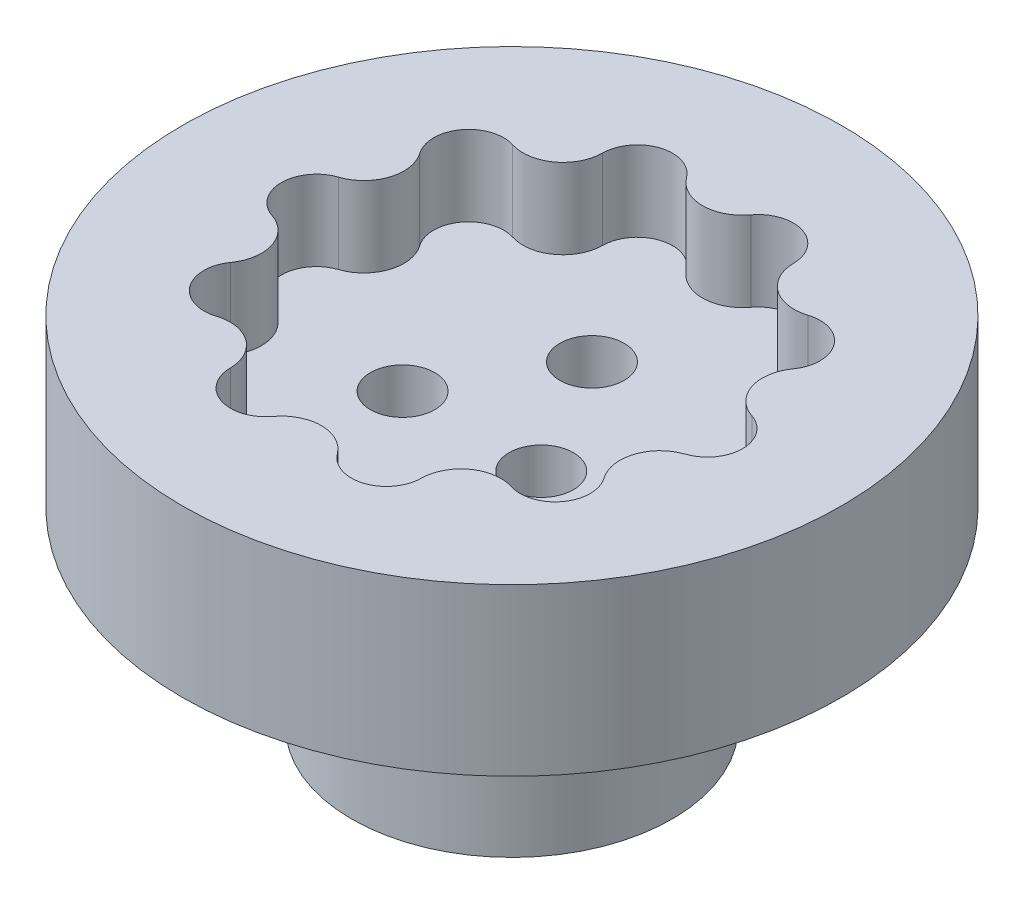
from build123d import *

# Parameters (mm, degrees)
SKETCH1_R               = 26.14295
BOSS_EXTRUDE1_DEPTH     = 6.810375
SKETCH2_R               = 12.7
BOSS_EXTRUDE2_DEPTH     = 15.08125
BOSS_EXTRUDE3_START     = 6.35
SKETCH3_R               = 26.14295
BOSS_EXTRUDE3_DEPTH     = 6.35
F_1_4_20_TAPPED_HOLE1_D = 5.1054


with BuildPart() as part:
    # Sketch1 → Boss-Extrude1 (new body)
    with BuildSketch(Plane(origin=(0, 0, 0), x_dir=(1, 0, 0), z_dir=(0, 1, 0))):
        Circle(SKETCH1_R)
    extrude(amount=-BOSS_EXTRUDE1_DEPTH)

    # Sketch2 → Boss-Extrude2 (add)
    with BuildSketch(Plane.XZ.offset(6.810375)):
        Circle(SKETCH2_R)
    extrude(amount=BOSS_EXTRUDE2_DEPTH)

    # Sketch3 → Boss-Extrude3 (add)
    with BuildSketch(Plane(origin=(0, 0, 0), x_dir=(1, 0, 0), z_dir=(0, 1, 0)).offset(BOSS_EXTRUDE3_START)):
        Circle(SKETCH3_R)
        with BuildLine():
            ThreePointArc((2.553003524, 16.40046245), (5.651302793, 17.39292157), (7.574526721, 14.768870658))
            ThreePointArc((7.574526721, 14.768870658), (7.926495509, 13.34211974), (8.883198518, 12.226673836))
            ThreePointArc((8.883198518, 12.226673836), (10.239688102, 11.661486946), (11.705373197, 11.767635017))
            ThreePointArc((11.705373197, 11.767635017), (14.795302793, 10.749416694), (14.808845207, 7.496072251))
            ThreePointArc((14.808845207, 7.496072251), (14.25497079, 6.134924448), (14.373317131, 4.670173836))
            ThreePointArc((14.373317131, 4.670173836), (15.138531738, 3.415603465), (16.386688159, 2.639970974))
            ThreePointArc((16.386688159, 2.639970974), (18.288, 0), (16.386688159, -2.639970974))
            ThreePointArc((16.386688159, -2.639970974), (15.138531738, -3.415603465), (14.373317131, -4.670173836))
            ThreePointArc((14.373317131, -4.670173836), (14.25497079, -6.134924448), (14.808845207, -7.496072251))
            ThreePointArc((14.808845207, -7.496072251), (14.795302793, -10.749416694), (11.705373197, -11.767635017))
            ThreePointArc((11.705373197, -11.767635017), (10.239688102, -11.661486946), (8.883198518, -12.226673836))
            ThreePointArc((8.883198518, -12.226673836), (7.926495509, -13.34211974), (7.574526721, -14.768870658))
            ThreePointArc((7.574526721, -14.768870658), (5.651302793, -17.39292157), (2.553003524, -16.40046245))
            ThreePointArc((2.553003524, -16.40046245), (1.429631644, -15.453078773), (0, -15.113))
            ThreePointArc((0, -15.113), (-1.429631644, -15.453078773), (-2.553003524, -16.40046245))
            ThreePointArc((-2.553003524, -16.40046245), (-5.651302793, -17.39292157), (-7.574526721, -14.768870658))
            ThreePointArc((-7.574526721, -14.768870658), (-7.926495509, -13.34211974), (-8.883198518, -12.226673836))
            ThreePointArc((-8.883198518, -12.226673836), (-10.239688102, -11.661486946), (-11.705373197, -11.767635017))
            ThreePointArc((-11.705373197, -11.767635017), (-14.795302793, -10.749416694), (-14.808845207, -7.496072251))
            ThreePointArc((-14.808845207, -7.496072251), (-14.25497079, -6.134924448), (-14.373317131, -4.670173836))
            ThreePointArc((-14.373317131, -4.670173836), (-15.138531738, -3.415603465), (-16.386688159, -2.639970974))
            ThreePointArc((-16.386688159, -2.639970974), (-18.288, 0), (-16.386688159, 2.639970974))
            ThreePointArc((-16.386688159, 2.639970974), (-15.138531738, 3.415603465), (-14.373317131, 4.670173836))
            ThreePointArc((-14.373317131, 4.670173836), (-14.25497079, 6.134924448), (-14.808845207, 7.496072251))
            ThreePointArc((-14.808845207, 7.496072251), (-14.795302793, 10.749416694), (-11.705373197, 11.767635017))
            ThreePointArc((-11.705373197, 11.767635017), (-10.239688102, 11.661486946), (-8.883198518, 12.226673836))
            ThreePointArc((-8.883198518, 12.226673836), (-7.926495509, 13.34211974), (-7.574526721, 14.768870658))
            ThreePointArc((-7.574526721, 14.768870658), (-5.651302793, 17.39292157), (-2.553003524, 16.40046245))
            ThreePointArc((-2.553003524, 16.40046245), (-1.429631644, 15.453078773), (0, 15.113))
            ThreePointArc((0, 15.113), (1.429631644, 15.453078773), (2.553003524, 16.40046245))
        make_face(mode=Mode.SUBTRACT)
    extrude(amount=-BOSS_EXTRUDE3_DEPTH)

    # 1/4-20 Tapped Hole1 (through all)
    with Locations(Plane(origin=(0, -21.891625, 0), x_dir=(-1, 0, 0), z_dir=(0, -1, 0))):
        with Locations((0, 6.35), (5.499261314, -3.175), (-5.499261314, -3.175)):
            Hole(F_1_4_20_TAPPED_HOLE1_D / 2)


solid = part.part
